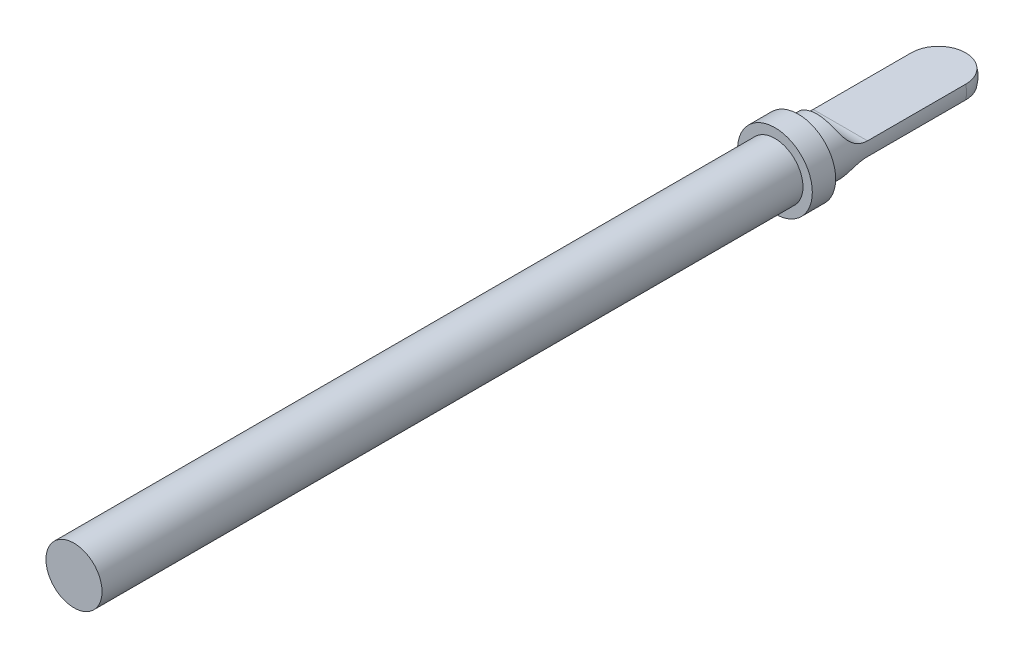
from build123d import *
from build123d.topology import SkipClean

# Parameters (mm, degrees)
SKETCH_1_R          = 6
EXTRUDE_1_DEPTH     = 150
SKETCH_2_R          = 8
EXTRUDE_2_DEPTH     = 5
EXTRUDE_START       = 30
SKETCH_3_R          = 6
EXTRUDE_5_DEPTH     = 30
SKETCH_9_W          = 19.221444034
SKETCH_9_H          = 5.745349359
CUT_EXTRUDE_7_DEPTH = 40
FILLET_4_R          = 5
FILLET_5_R          = 5


with BuildPart() as part:
    # 草图1 → 凸台-拉伸1 (new body)
    with BuildSketch(Plane.XY):
        Circle(SKETCH_1_R)
    extrude(amount=EXTRUDE_1_DEPTH)

    # 草图2 → 凸台-拉伸2 (add)
    with BuildSketch(Plane.XY):
        Circle(SKETCH_2_R)
    extrude(amount=-EXTRUDE_2_DEPTH)

    # 草图3 → 凸台-拉伸5 (add)
    with BuildSketch(Plane(origin=(0, 0, -5), x_dir=(-1, 0, 0), z_dir=(0, 0, -1)).offset(EXTRUDE_START)):
        with Locations(Location((0, 0, 0), (0, 0, 180))):
            Circle(SKETCH_3_R)
    extrude(amount=-EXTRUDE_5_DEPTH)

    # 草图8 one side → 旋转8 (revolve)
    with SkipClean():  # the faces are left unmerged after this step: merging them gives an invalid solid
        with BuildSketch(Plane(origin=(0, 0, -35), x_dir=(-1, 0, 0), z_dir=(0, 0, -1))):
            with BuildLine():
                Line((0, 6), (0, -6))
                ThreePointArc((0, -6), (4.242640687, -4.242640687), (6, 0))
                ThreePointArc((6, 0), (4.242640687, 4.242640687), (0, 6))
            make_face()
        revolve(axis=Axis((0, 0, -35), (0, -1, 0)))

    # 草图9 → 切除-拉伸7 (cut)
    with BuildSketch(Plane(origin=(0, 0, -9), x_dir=(-1, 0, 0), z_dir=(0, 0, -1))):
        with Locations((0.738599267, 4.336128304)):
            Rectangle(SKETCH_9_W, SKETCH_9_H)
        with Locations((0.738599267, -4.336128304)):
            Rectangle(SKETCH_9_W, SKETCH_9_H)
    extrude(amount=CUT_EXTRUDE_7_DEPTH, mode=Mode.SUBTRACT)

    # 圆角4
    # the kernel refuses this fillet: 5 mm, written as the material it adds along each edge
    with BuildSketch(Plane(origin=(18.318788834, 1.463453624, -9), x_dir=(0, 0, -1), z_dir=(-1, 0, 0))) as fillet_4_piece_1_section:
        with BuildLine():
            CenterArc((FILLET_4_R, -FILLET_4_R), FILLET_4_R, 90, 90)
            Line((0, -FILLET_4_R), (0, 0))
            Line((0, 0), (FILLET_4_R, 0))
        make_face()
    fillet_4_piece_1 = extrude(amount=36.637577667, mode=Mode.PRIVATE)
    fillet_4_piece_1 = fillet_4_piece_1 & Plane(origin=(0, 0, -10.216169301), x_dir=(1, 0, 0), z_dir=(0, 0, -1)) * Cylinder(6, 94, mode=Mode.PRIVATE)
    add(fillet_4_piece_1)

    # 圆角5
    # the kernel refuses this fillet: 5 mm, written as the material it adds along each edge
    with BuildSketch(Plane(origin=(18.318788834, -1.463453624, -9), x_dir=(0, 0, -1), z_dir=(-1, 0, 0))) as fillet_5_piece_1_section:
        with BuildLine():
            CenterArc((FILLET_5_R, FILLET_5_R), FILLET_5_R, 180, 90)
            Line((0, FILLET_5_R), (0, 0))
            Line((0, 0), (FILLET_5_R, 0))
        make_face()
    fillet_5_piece_1 = extrude(amount=36.637577667, mode=Mode.PRIVATE)
    fillet_5_piece_1 = fillet_5_piece_1 & Plane(origin=(0, 0, -10.216169301), x_dir=(1, 0, 0), z_dir=(0, 0, -1)) * Cylinder(6, 94, mode=Mode.PRIVATE)
    add(fillet_5_piece_1)


solid = part.part
